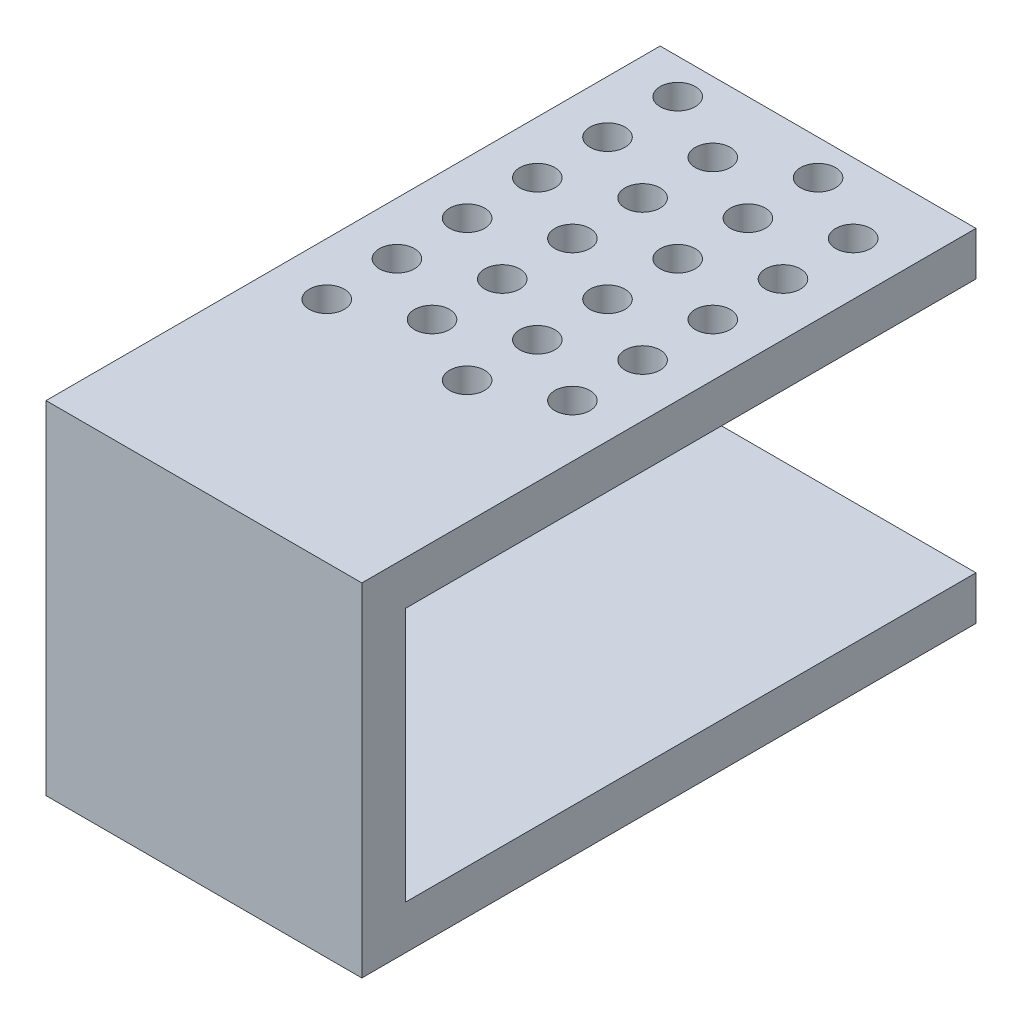
from build123d import *

# Parameters (mm, degrees)
SKETCH2_W           = 18
SKETCH2_H           = 24
SKETCH2_R           = 1
BOSS_EXTRUDE2_DEPTH = 2.5
SKETCH3_W           = 18
SKETCH3_H           = 2.5
BOSS_EXTRUDE3_DEPTH = 11
SKETCH4_W           = 18
SKETCH4_H           = 2.5
BOSS_EXTRUDE4_DEPTH = 17
SKETCH5_W           = 18
SKETCH5_H           = 2.5
BOSS_EXTRUDE5_DEPTH = 32.5


with BuildPart() as part:
    # Sketch2 → Boss-Extrude2 (new body)
    with BuildSketch(Plane(origin=(0, 0, 0), x_dir=(1, 0, 0), z_dir=(0, 1, 0))):
        with Locations((-11, 4)):
            Rectangle(SKETCH2_W, SKETCH2_H)
        with Locations((-17, -6)):
            Circle(SKETCH2_R, mode=Mode.SUBTRACT)
        with Locations((-17, -2)):
            Circle(SKETCH2_R, mode=Mode.SUBTRACT)
        with Locations((-17, 2)):
            Circle(SKETCH2_R, mode=Mode.SUBTRACT)
        with Locations((-17, 6)):
            Circle(SKETCH2_R, mode=Mode.SUBTRACT)
        with Locations((-17, 10)):
            Circle(SKETCH2_R, mode=Mode.SUBTRACT)
        with Locations((-17, 14)):
            Circle(SKETCH2_R, mode=Mode.SUBTRACT)
        with Locations((-13, -4)):
            Circle(SKETCH2_R, mode=Mode.SUBTRACT)
        with Locations((-13, 0)):
            Circle(SKETCH2_R, mode=Mode.SUBTRACT)
        with Locations((-13, 4)):
            Circle(SKETCH2_R, mode=Mode.SUBTRACT)
        with Locations((-13, 8)):
            Circle(SKETCH2_R, mode=Mode.SUBTRACT)
        with Locations((-13, 12)):
            Circle(SKETCH2_R, mode=Mode.SUBTRACT)
        with Locations((-9, -6)):
            Circle(SKETCH2_R, mode=Mode.SUBTRACT)
        with Locations((-9, -2)):
            Circle(SKETCH2_R, mode=Mode.SUBTRACT)
        with Locations((-9, 2)):
            Circle(SKETCH2_R, mode=Mode.SUBTRACT)
        with Locations((-9, 6)):
            Circle(SKETCH2_R, mode=Mode.SUBTRACT)
        with Locations((-9, 10)):
            Circle(SKETCH2_R, mode=Mode.SUBTRACT)
        with Locations((-9, 14)):
            Circle(SKETCH2_R, mode=Mode.SUBTRACT)
        with Locations((-5, -4)):
            Circle(SKETCH2_R, mode=Mode.SUBTRACT)
        with Locations((-5, 0)):
            Circle(SKETCH2_R, mode=Mode.SUBTRACT)
        with Locations((-5, 4)):
            Circle(SKETCH2_R, mode=Mode.SUBTRACT)
        with Locations((-5, 8)):
            Circle(SKETCH2_R, mode=Mode.SUBTRACT)
        with Locations((-5, 12)):
            Circle(SKETCH2_R, mode=Mode.SUBTRACT)
    extrude(amount=BOSS_EXTRUDE2_DEPTH)

    # Sketch3 → Boss-Extrude3 (add)
    with BuildSketch(Plane.XY.offset(8)):
        with Locations((-11, 1.25)):
            Rectangle(SKETCH3_W, SKETCH3_H)
    extrude(amount=BOSS_EXTRUDE3_DEPTH)

    # Sketch4 → Boss-Extrude4 (add)
    with BuildSketch(Plane(origin=(0, 0, 0), x_dir=(-1, 0, 0), z_dir=(0, -1, 0))):
        with Locations((11, -17.75)):
            Rectangle(SKETCH4_W, SKETCH4_H)
    extrude(amount=BOSS_EXTRUDE4_DEPTH)

    # Sketch5 → Boss-Extrude5 (add)
    with BuildSketch(Plane(origin=(0, 0, 16.5), x_dir=(-1, 0, 0), z_dir=(0, 0, -1))):
        with Locations((11, -15.75)):
            Rectangle(SKETCH5_W, SKETCH5_H)
    extrude(amount=BOSS_EXTRUDE5_DEPTH)


solid = part.part
